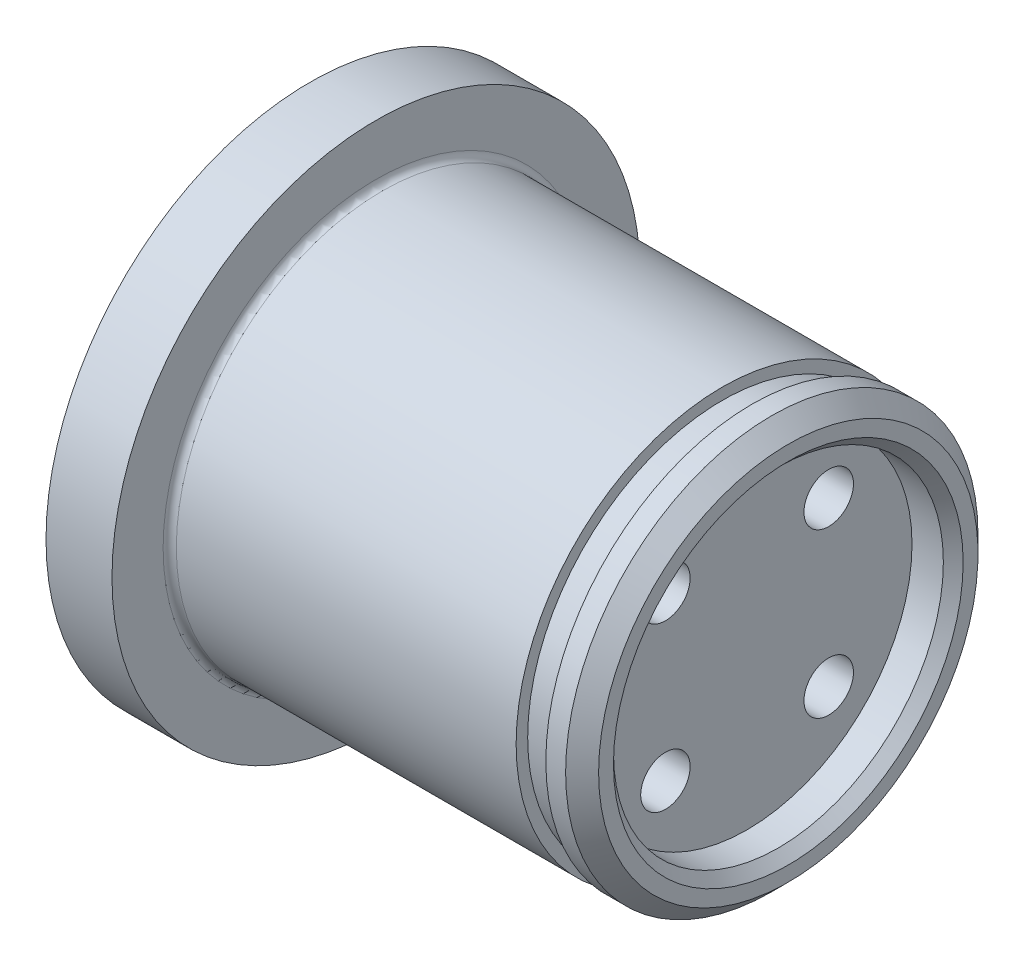
from build123d import *

# Parameters (mm, degrees)
SKETCH_2_W               = 1.8
SKETCH_2_H               = 0.7
CHAMFER_1_SIZE           = 1
FILLET_1_R               = 0.4
HOLE_WIZARD_1_D          = 3
PATTERN_CIRCULAR_1_COUNT = 4
SKETCH_5_W               = 2.5
SKETCH_5_H               = 10
CHAMFER_2_SIZE           = 0.6


with BuildPart() as part:
    # Эскиз1 → Повернуть1 (revolve)
    with BuildSketch(Plane.XY):
        Polygon((0, 0), (0, 12.5), (-25, 12.5), (-25, 16), (-29, 16), (-29, 0), align=None)
    revolve(axis=Axis((0, 0, 0), (1, 0, 0)))

    # Эскиз2 → Вырез-Повернуть1 (revolve, cut)
    with BuildSketch(Plane.XY):
        with Locations((-3.1, 12.15)):
            Rectangle(SKETCH_2_W, SKETCH_2_H)
    revolve(axis=Axis((0, 0, 0), (-1, 0, 0)), mode=Mode.SUBTRACT)

    # Фаска1
    chamfer_1_edges = [part.edges().sort_by_distance(p)[0] for p in [
        (0, -12.5, 0),
    ]]
    chamfer(chamfer_1_edges, length=CHAMFER_1_SIZE)

    # Скругление1
    fillet_1_edges = [part.edges().sort_by_distance(p)[0] for p in [
        (-25, -12.5, 0),
    ]]
    fillet(fillet_1_edges, radius=FILLET_1_R)

    # Отверстие1 (through all)
    with Locations(Plane(origin=(0, 0, 0), x_dir=(0, 0, -1), z_dir=(1, 0, 0))):
        with Locations((4.949747468, 4.949747468)):
            hole_wizard_1 = Hole(HOLE_WIZARD_1_D / 2)

    # Круговой массив1: Отверстие1 ×4 about axis
    pattern_circular_1_axis = Axis((0, 0, 0), (-1, 0, 0))
    for i in range(1, PATTERN_CIRCULAR_1_COUNT):
        add(hole_wizard_1.rotate(pattern_circular_1_axis, i * 360 / PATTERN_CIRCULAR_1_COUNT), mode=Mode.SUBTRACT)

    # Эскиз5 → Вырез-Повернуть2 (revolve, cut)
    with BuildSketch(Plane.XY):
        with Locations((-1.25, 5)):
            Rectangle(SKETCH_5_W, SKETCH_5_H)
    revolve(axis=Axis((0, 0, 0), (-1, 0, 0)), mode=Mode.SUBTRACT)

    # Фаска2
    chamfer_2_edges = [part.edges().sort_by_distance(p)[0] for p in [
        (0, -10, 0),
    ]]
    chamfer(chamfer_2_edges, length=CHAMFER_2_SIZE)


solid = part.part
